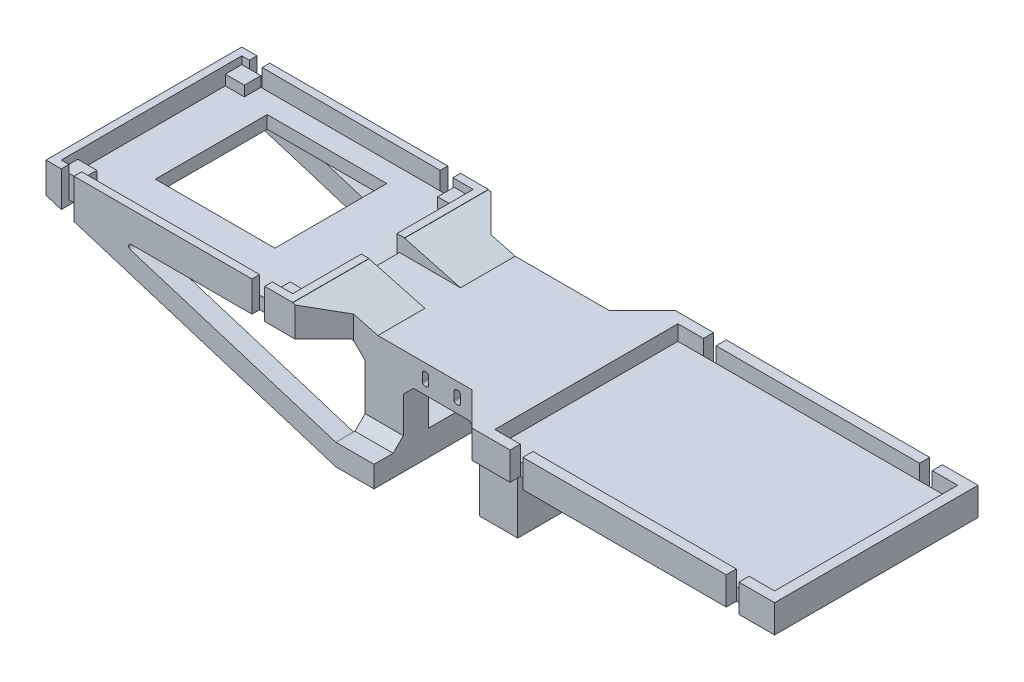
from build123d import *

# Parameters (mm, degrees)
SKETCH2_W            = 54
SKETCH2_H            = 41.5
SKETCH2_W_2          = 34
SKETCH2_H_2          = 20.5
BOSS_EXTRUDE1_DEPTH  = 80
CUT_EXTRUDE2_REACH   = 103.224
SKETCH4_W            = 30
SKETCH4_H            = 30.5
SKETCH4_W_2          = 20
SKETCH7_W            = 91
SKETCH7_H            = 71
BOSS_EXTRUDE2_DEPTH  = 5
SKETCH8_W            = 47
SKETCH8_H            = 44
CUT_EXTRUDE3_DEPTH   = 6
SKETCH10_W           = 97
SKETCH10_H           = 77
BOSS_EXTRUDE3_DEPTH  = 12
SKETCH11_W           = 7.5
SKETCH11_H           = 6.5
BOSS_EXTRUDE4_DEPTH  = 4
SKETCH12_W           = 3
SKETCH12_H           = 14
CUT_EXTRUDE5_DEPTH   = 6
SKETCH13_W           = 2.5
SKETCH13_H           = 5
CUT_EXTRUDE6_DEPTH   = 54
BOSS_EXTRUDE5_REACH  = 194.705
CUT_EXTRUDE8_REACH   = 186.43
SKETCH18_W           = 114
SKETCH18_H           = 63
CHAMFER2_SIZE        = 5
FILLET1_R            = 1
CHAMFER3_SIZE        = 4
CHAMFER4_SIZE        = 12.5
FILLET2_R            = 1
CHAMFER5_SIZE        = 1
FILLET2_OF_MIRROR1_R = 1
BOSS_EXTRUDE6_START  = -5
SKETCH19_W           = 110
SKETCH19_H           = 72
BOSS_EXTRUDE6_DEPTH  = 5
BOSS_EXTRUDE7_START  = -5
SKETCH21_W           = 118
SKETCH21_H           = 80
BOSS_EXTRUDE7_DEPTH  = 11
CHAMFER7_SIZE        = 14
CUT_EXTRUDE9_REACH   = 185.298
SKETCH22_W           = 5
SKETCH22_H           = 4
CUT_EXTRUDE10_START  = -12
SKETCH23_W           = 5
SKETCH23_H           = 3
CUT_EXTRUDE10_DEPTH  = 12
CUT_EXTRUDE11_REACH  = 184.034
SKETCH24_W           = 5
SKETCH24_H           = 77
CHAMFER8_SIZE        = 22
CHAMFER8_SIZE2       = 5.894882233


# Some blends are built 0.0001 mm under size
with BuildPart() as part:
    # Sketch2 → Boss-Extrude1 (new body)
    with BuildSketch(Plane(origin=(0, 0, 0), x_dir=(0, 0, -1), z_dir=(1, 0, 0))):
        with Locations((0, -9.75)):
            Rectangle(SKETCH2_W, SKETCH2_H)
        with Locations((0, -10.25)):
            Rectangle(SKETCH2_W_2, SKETCH2_H_2, mode=Mode.SUBTRACT)
    extrude(amount=-BOSS_EXTRUDE1_DEPTH)

    # Cut-Extrude2: up to this face of the body (flat: up to its plane)
    cut_extrude2_end = Plane(part.part.faces().sort_by_distance((-40, -9.75, -27))[0])
    # Sketch4 → Cut-Extrude2 (cut, up to the picked face)
    with BuildSketch(Plane.XY.offset(27), mode=Mode.PRIVATE) as cut_extrude2_sk1:
        with Locations((-30, -15.25)):
            Rectangle(SKETCH4_W, SKETCH4_H)
    cut_extrude2_tool1 = split(extrude(cut_extrude2_sk1.sketch, amount=-CUT_EXTRUDE2_REACH, mode=Mode.PRIVATE), bisect_by=cut_extrude2_end, keep=Keep.BOTH, mode=Mode.PRIVATE)
    # Sketch4 → Cut-Extrude2 (cut, up to the picked face)
    with BuildSketch(Plane.XY.offset(27), mode=Mode.PRIVATE) as cut_extrude2_sk2:
        with Locations((-70, -15.25)):
            Rectangle(SKETCH4_W_2, SKETCH4_H)
    cut_extrude2_tool2 = split(extrude(cut_extrude2_sk2.sketch, amount=-CUT_EXTRUDE2_REACH, mode=Mode.PRIVATE), bisect_by=cut_extrude2_end, keep=Keep.BOTH, mode=Mode.PRIVATE)
    add(cut_extrude2_tool1.solids().sort_by(Axis((-30, -15.25, 27), (0, 0, -1)))[0], mode=Mode.SUBTRACT)
    add(cut_extrude2_tool2.solids().sort_by(Axis((-70, -15.25, 27), (0, 0, -1)))[0], mode=Mode.SUBTRACT)

    # Sketch7 → Boss-Extrude2 (add)
    with BuildSketch(Plane(origin=(0, 5, 0), x_dir=(1, 0, 0), z_dir=(0, 1, 0))):
        with Locations((-125.5, 0)):
            Rectangle(SKETCH7_W, SKETCH7_H)
    extrude(amount=BOSS_EXTRUDE2_DEPTH)

    # Sketch8 → Cut-Extrude3 (cut)
    with BuildSketch(Plane(origin=(0, 11, 0), x_dir=(1, 0, 0), z_dir=(0, 1, 0))):
        with Locations((-129.5, 5.5)):
            Rectangle(SKETCH8_W, SKETCH8_H)
    extrude(amount=-CUT_EXTRUDE3_DEPTH, mode=Mode.SUBTRACT)

    # Sketch10 → Boss-Extrude3 (add)
    with BuildSketch(Plane.XZ.offset(-5)):
        with Locations((-125.5, 0)):
            Rectangle(SKETCH10_W, SKETCH10_H)
        Polygon((-80, 27), (-80, 35.5), (-171, 35.5), (-171, -35.5), (-80, -35.5), (-80, -27), align=None, mode=Mode.SUBTRACT)
    extrude(amount=-BOSS_EXTRUDE3_DEPTH)

    # Sketch11 → Boss-Extrude4 (add)
    with BuildSketch(Plane(origin=(0, 10, 0), x_dir=(1, 0, 0), z_dir=(0, 1, 0))):
        with Locations((-167.25, -32.25)):
            Rectangle(SKETCH11_W, SKETCH11_H)
        with Locations((-83.75, -32.25)):
            Rectangle(SKETCH11_W, SKETCH11_H)
        with Locations((-83.75, 32.25)):
            Rectangle(SKETCH11_W, SKETCH11_H)
        with Locations((-167.25, 32.25)):
            Rectangle(SKETCH11_W, SKETCH11_H)
    extrude(amount=BOSS_EXTRUDE4_DEPTH)

    # Sketch12 → Cut-Extrude5 (cut)
    with BuildSketch(Plane(origin=(0, 17, 0), x_dir=(1, 0, 0), z_dir=(0, 1, 0))):
        with Locations((-78.5, -1.5)):
            Rectangle(SKETCH12_W, SKETCH12_H)
    extrude(amount=-CUT_EXTRUDE5_DEPTH, mode=Mode.SUBTRACT)

    # Sketch13 → Cut-Extrude6 (cut)
    with BuildSketch(Plane.XY.offset(27)):
        with Locations((-23.75, 5.5)):
            Rectangle(SKETCH13_W, SKETCH13_H)
    cut_extrude6 = extrude(amount=-CUT_EXTRUDE6_DEPTH, mode=Mode.SUBTRACT)

    # Boss-Extrude5: up to this face of the body (flat: up to its plane)
    boss_extrude5_end = Plane(part.part.faces().sort_by_distance((-125.5, 11, -38.5))[0])
    # Sketch15 → Boss-Extrude5 (add, up to the picked face)
    with BuildSketch(Plane.XY.offset(38.5), mode=Mode.PRIVATE) as boss_extrude5_sk1:
        Polygon((-174, 5), (-60, -30.5), (-45, -30.5), (-45, -22.121084957), (-60, -22.121084957), (-147.093061552, 5), align=None)
    boss_extrude5_tool1 = split(extrude(boss_extrude5_sk1.sketch, amount=-BOSS_EXTRUDE5_REACH, mode=Mode.PRIVATE), bisect_by=boss_extrude5_end, keep=Keep.BOTH, mode=Mode.PRIVATE)
    add(boss_extrude5_tool1.solids().sort_by(Axis((-103.034337, -12.768903, 38.5), (0, 0, -1)))[0])

    # Cut-Extrude8: up to this face of the body (flat: up to its plane)
    cut_extrude8_end = Plane(part.part.faces().sort_by_distance((-105.982216644, 5, 2.901755115))[0])
    # Sketch18 → Cut-Extrude8 (cut, up to the picked face)
    with BuildSketch(Plane.XZ.offset(30.5), mode=Mode.PRIVATE) as cut_extrude8_sk1:
        with Locations((-117, 0)):
            Rectangle(SKETCH18_W, SKETCH18_H)
    cut_extrude8_tool1 = split(extrude(cut_extrude8_sk1.sketch, amount=-CUT_EXTRUDE8_REACH, mode=Mode.PRIVATE), bisect_by=cut_extrude8_end, keep=Keep.BOTH, mode=Mode.PRIVATE)
    add(cut_extrude8_tool1.solids().sort_by(Axis((-117, -30.5, 0), (0, 1, 0)))[0], mode=Mode.SUBTRACT)

    # Chamfer2
    chamfer2_edges = [part.edges().sort_by_distance(p)[0] for p in [
        (-60, 5, 0),
    ]]
    chamfer(chamfer2_edges, length=CHAMFER2_SIZE - 0.0001)  # a hair under: the kernel refuses the full size

    # Fillet1
    fillet1_edges = [part.edges().sort_by_distance(p)[0] for p in [
        (-60, -22.121084957, -35),
        (-147.093061552, 5, -35),
        (-147.093061552, 5, 35),
        (-60, -22.121084957, 35),
    ]]
    fillet(fillet1_edges, radius=FILLET1_R)

    # Chamfer3
    chamfer3_edges = [part.edges().sort_by_distance(p)[0] for p in [
        (-52.5, -22.121084957, 27),
        (-52.5, -22.121084957, -27),
        (-45, 0, 22),
        (-45, 0, -22),
        (-15, 0, 22),
        (-15, 0, -22),
    ]]
    chamfer(chamfer3_edges, length=CHAMFER3_SIZE)

    # Chamfer4
    # the kernel refuses this chamfer: 12.5 mm, written as the material it adds along each edge
    with BuildSketch(Plane(origin=(-77, 11, 27), x_dir=(-0.027495876610586587, 0, 0.9996219169112966), z_dir=(0, -1, 0))) as chamfer4_piece_1_section:
        Polygon((CHAMFER4_SIZE * 0.999621916911, -CHAMFER4_SIZE * 0.0274958766106), (-CHAMFER4_SIZE * 0.0274958766106, -CHAMFER4_SIZE * 0.999621916911), (0, 0), align=None)
    chamfer4_piece_1 = extrude(amount=6, mode=Mode.PRIVATE)
    chamfer4_piece_1 = split(chamfer4_piece_1, bisect_by=Plane(origin=(-68.359552988, 8.359652988, 28.292902516), z_dir=(0.7071067811865472, 0.7071067811865478, 0)), keep=Keep.TOP, mode=Mode.PRIVATE)
    add(chamfer4_piece_1)
    with BuildSketch(Plane(origin=(-77, 11, 27), x_dir=(-0.027495876610586587, 0, 0.9996219169112966), z_dir=(0, -1, 0))) as chamfer4_piece_2_section:
        Polygon((CHAMFER4_SIZE * 0.999621916911, -CHAMFER4_SIZE * 0.0274958766106), (-CHAMFER4_SIZE * 0.0274958766106, -CHAMFER4_SIZE * 0.999621916911), (0, 0), align=None)
    chamfer4_piece_2 = extrude(amount=38.14603735, mode=Mode.PRIVATE)
    chamfer4_piece_2 = split(chamfer4_piece_2, bisect_by=Plane(origin=(-64.503738194, 5, 26.714487269), z_dir=(0, -1, 0)), keep=Keep.TOP, mode=Mode.PRIVATE)
    chamfer4_piece_2 = split(chamfer4_piece_2, bisect_by=Plane(origin=(-64.627778646, 4.627878646, 26.714487269), z_dir=(0.7071067811865472, 0.7071067811865478, 0)), keep=Keep.TOP, mode=Mode.PRIVATE)
    add(chamfer4_piece_2)
    with BuildSketch(Plane(origin=(-77, 11, 27), x_dir=(-0.027495876610586587, 0, 0.9996219169112966), z_dir=(0, -1, 0))) as chamfer4_piece_3_section:
        Polygon((CHAMFER4_SIZE * 0.999621916911, -CHAMFER4_SIZE * 0.0274958766106), (-CHAMFER4_SIZE * 0.0274958766106, -CHAMFER4_SIZE * 0.999621916911), (0, 0), align=None)
    chamfer4_piece_3 = extrude(amount=6, mode=Mode.PRIVATE)
    chamfer4_piece_3 = split(chamfer4_piece_3, bisect_by=Plane(origin=(-73.477032912, 7.846772168, 38.5), z_dir=(0, 0, -1)), keep=Keep.TOP, mode=Mode.PRIVATE)
    chamfer4_piece_3 = split(chamfer4_piece_3, bisect_by=Plane(origin=(-70.66185254, 10.66195254, 31.346666283), z_dir=(-0.7071067811865472, -0.7071067811865478, 0)), keep=Keep.TOP, mode=Mode.PRIVATE)
    add(chamfer4_piece_3)
    with BuildSketch(Plane(origin=(-77, -27.14603735, -27), x_dir=(-0.027495876610586587, 0, -0.9996219169112966), z_dir=(0, 1, 0))) as chamfer4_piece_4_section:
        Polygon((CHAMFER4_SIZE * 0.999621916911, -CHAMFER4_SIZE * 0.0274958766106), (-CHAMFER4_SIZE * 0.0274958766106, -CHAMFER4_SIZE * 0.999621916911), (0, 0), align=None)
    chamfer4_piece_4 = extrude(amount=38.14603735, mode=Mode.PRIVATE)
    chamfer4_piece_4 = split(chamfer4_piece_4, bisect_by=Plane(origin=(-64.627778646, 4.627878646, -26.714487269), z_dir=(0.7071067811865472, 0.7071067811865478, 0)), keep=Keep.TOP, mode=Mode.PRIVATE)
    chamfer4_piece_4 = split(chamfer4_piece_4, bisect_by=Plane(origin=(-64.503738194, 5, -26.714487269), z_dir=(0, -1, 0)), keep=Keep.TOP, mode=Mode.PRIVATE)
    add(chamfer4_piece_4)
    with BuildSketch(Plane(origin=(-77, 5, -27), x_dir=(-0.027495876610586587, 0, -0.9996219169112966), z_dir=(0, 1, 0))) as chamfer4_piece_5_section:
        Polygon((CHAMFER4_SIZE * 0.999621916911, -CHAMFER4_SIZE * 0.0274958766106), (-CHAMFER4_SIZE * 0.0274958766106, -CHAMFER4_SIZE * 0.999621916911), (0, 0), align=None)
    chamfer4_piece_5 = extrude(amount=6, mode=Mode.PRIVATE)
    chamfer4_piece_5 = split(chamfer4_piece_5, bisect_by=Plane(origin=(-73.477032912, 7.846772168, -38.5), z_dir=(0, 0, 1)), keep=Keep.TOP, mode=Mode.PRIVATE)
    chamfer4_piece_5 = split(chamfer4_piece_5, bisect_by=Plane(origin=(-70.66185254, 10.66195254, -31.346666283), z_dir=(-0.7071067811865472, -0.7071067811865478, 0)), keep=Keep.TOP, mode=Mode.PRIVATE)
    add(chamfer4_piece_5)
    with BuildSketch(Plane(origin=(-77, 5, -27), x_dir=(-0.027495876610586587, 0, -0.9996219169112966), z_dir=(0, 1, 0))) as chamfer4_piece_6_section:
        Polygon((CHAMFER4_SIZE * 0.999621916911, -CHAMFER4_SIZE * 0.0274958766106), (-CHAMFER4_SIZE * 0.0274958766106, -CHAMFER4_SIZE * 0.999621916911), (0, 0), align=None)
    chamfer4_piece_6 = extrude(amount=6, mode=Mode.PRIVATE)
    chamfer4_piece_6 = split(chamfer4_piece_6, bisect_by=Plane(origin=(-68.359552988, 8.359652988, -28.292902516), z_dir=(0.7071067811865472, 0.7071067811865478, 0)), keep=Keep.TOP, mode=Mode.PRIVATE)
    add(chamfer4_piece_6)

    # Fillet2
    fillet2_edges = [part.edges().sort_by_distance(p)[0] for p in [
        (-22.5, 3, 0),
        (-22.5, 8, 0),
        (-25, 8, 0),
        (-25, 3, 0),
    ]]
    fillet(fillet2_edges, radius=FILLET2_R)

    # Chamfer5
    chamfer5_edges = [part.edges().sort_by_distance(p)[0] for p in [
        (-80, 11, 1.5),
    ]]
    chamfer(chamfer5_edges, length=CHAMFER5_SIZE - 0.0001)  # a hair under: the kernel refuses the full size

    # Mirror1: Cut-Extrude6 across plane
    add(cut_extrude6.mirror(Plane(origin=(-30, 0, 0), x_dir=(0, 0, 1), z_dir=(1, 0, 0))), mode=Mode.SUBTRACT)

    # Fillet2 of Mirror1
    fillet2_of_mirror1_edges = [part.edges().sort_by_distance(p)[0] for p in [
        (-37.5, 3, 0),
        (-37.5, 8, 0),
        (-35, 8, 0),
        (-35, 3, 0),
    ]]
    fillet(fillet2_of_mirror1_edges, radius=FILLET2_OF_MIRROR1_R)

    # Sketch19 → Boss-Extrude6 (add)
    with BuildSketch(Plane(origin=(0, 5, 0), x_dir=(1, 0, 0), z_dir=(0, 1, 0)).offset(BOSS_EXTRUDE6_START)):
        with Locations((55, 0)):
            Rectangle(SKETCH19_W, SKETCH19_H)
    extrude(amount=BOSS_EXTRUDE6_DEPTH)

    # Sketch21 → Boss-Extrude7 (add)
    with BuildSketch(Plane(origin=(0, 5, 0), x_dir=(1, 0, 0), z_dir=(0, 1, 0)).offset(BOSS_EXTRUDE7_START)):
        with Locations((55, 0)):
            Rectangle(SKETCH21_W, SKETCH21_H)
        Polygon((0, 36), (0, 27), (0, -27), (0, -36), (110, -36), (110, 36), align=None, mode=Mode.SUBTRACT)
    extrude(amount=BOSS_EXTRUDE7_DEPTH)

    # Chamfer7
    # the kernel refuses this chamfer: 14 mm, written as the material it adds along each edge
    with BuildSketch(Plane(origin=(-4, 0, -27), x_dir=(-0.9996219169112968, 0, 0.02749587661058612), z_dir=(0, 1, 0))) as chamfer7_piece_1_section:
        Polygon((CHAMFER7_SIZE * 0.999621916911, -CHAMFER7_SIZE * 0.0274958766106), (-CHAMFER7_SIZE * 0.0274958766106, -CHAMFER7_SIZE * 0.999621916911), (0, 0), align=None)
    chamfer7_piece_1 = extrude(amount=11, mode=Mode.PRIVATE)
    chamfer7_piece_1 = split(chamfer7_piece_1, bisect_by=Plane(origin=(-16, 5.5, -40), z_dir=(0, 0, 1)), keep=Keep.TOP, mode=Mode.PRIVATE)
    add(chamfer7_piece_1)
    with BuildSketch(Plane(origin=(-4, 11, 27), x_dir=(-0.9996219169112968, 0, -0.02749587661058612), z_dir=(0, -1, 0))) as chamfer7_piece_2_section:
        Polygon((CHAMFER7_SIZE * 0.999621916911, -CHAMFER7_SIZE * 0.0274958766106), (-CHAMFER7_SIZE * 0.0274958766106, -CHAMFER7_SIZE * 0.999621916911), (0, 0), align=None)
    chamfer7_piece_2 = extrude(amount=11, mode=Mode.PRIVATE)
    chamfer7_piece_2 = split(chamfer7_piece_2, bisect_by=Plane(origin=(-16, 5.5, 40), z_dir=(0, 0, -1)), keep=Keep.TOP, mode=Mode.PRIVATE)
    add(chamfer7_piece_2)

    # Cut-Extrude9: up to this face of the body (flat: up to its plane)
    cut_extrude9_end = Plane(part.part.faces().sort_by_distance((37.275205199, 0, 0))[0])
    # Sketch22 → Cut-Extrude9 (cut, up to the picked face)
    with BuildSketch(Plane(origin=(0, 11, 0), x_dir=(1, 0, 0), z_dir=(0, 1, 0)), mode=Mode.PRIVATE) as cut_extrude9_sk1:
        with Locations((97.5, 38)):
            Rectangle(SKETCH22_W, SKETCH22_H)
    cut_extrude9_tool1 = split(extrude(cut_extrude9_sk1.sketch, amount=-CUT_EXTRUDE9_REACH, mode=Mode.PRIVATE), bisect_by=cut_extrude9_end, keep=Keep.BOTH, mode=Mode.PRIVATE)
    # Sketch22 → Cut-Extrude9 (cut, up to the picked face)
    with BuildSketch(Plane(origin=(0, 11, 0), x_dir=(1, 0, 0), z_dir=(0, 1, 0)), mode=Mode.PRIVATE) as cut_extrude9_sk2:
        with Locations((97.5, -38)):
            Rectangle(SKETCH22_W, SKETCH22_H)
    cut_extrude9_tool2 = split(extrude(cut_extrude9_sk2.sketch, amount=-CUT_EXTRUDE9_REACH, mode=Mode.PRIVATE), bisect_by=cut_extrude9_end, keep=Keep.BOTH, mode=Mode.PRIVATE)
    # Sketch22 → Cut-Extrude9 (cut, up to the picked face)
    with BuildSketch(Plane(origin=(0, 11, 0), x_dir=(1, 0, 0), z_dir=(0, 1, 0)), mode=Mode.PRIVATE) as cut_extrude9_sk3:
        with Locations((12.5, -38)):
            Rectangle(SKETCH22_W, SKETCH22_H)
    cut_extrude9_tool3 = split(extrude(cut_extrude9_sk3.sketch, amount=-CUT_EXTRUDE9_REACH, mode=Mode.PRIVATE), bisect_by=cut_extrude9_end, keep=Keep.BOTH, mode=Mode.PRIVATE)
    # Sketch22 → Cut-Extrude9 (cut, up to the picked face)
    with BuildSketch(Plane(origin=(0, 11, 0), x_dir=(1, 0, 0), z_dir=(0, 1, 0)), mode=Mode.PRIVATE) as cut_extrude9_sk4:
        with Locations((12.5, 38)):
            Rectangle(SKETCH22_W, SKETCH22_H)
    cut_extrude9_tool4 = split(extrude(cut_extrude9_sk4.sketch, amount=-CUT_EXTRUDE9_REACH, mode=Mode.PRIVATE), bisect_by=cut_extrude9_end, keep=Keep.BOTH, mode=Mode.PRIVATE)
    add(cut_extrude9_tool1.solids().sort_by(Axis((97.5, 11, -38), (0, -1, 0)))[0], mode=Mode.SUBTRACT)
    add(cut_extrude9_tool2.solids().sort_by(Axis((97.5, 11, 38), (0, -1, 0)))[0], mode=Mode.SUBTRACT)
    add(cut_extrude9_tool3.solids().sort_by(Axis((12.5, 11, 38), (0, -1, 0)))[0], mode=Mode.SUBTRACT)
    add(cut_extrude9_tool4.solids().sort_by(Axis((12.5, 11, -38), (0, -1, 0)))[0], mode=Mode.SUBTRACT)

    # Sketch23 → Cut-Extrude10 (cut)
    with BuildSketch(Plane(origin=(0, 17, 0), x_dir=(1, 0, 0), z_dir=(0, 1, 0)).offset(CUT_EXTRUDE10_START)):
        with Locations((-165.5, 37)):
            Rectangle(SKETCH23_W, SKETCH23_H)
        with Locations((-90.5, 37)):
            Rectangle(SKETCH23_W, SKETCH23_H)
        with Locations((-90.5, -37)):
            Rectangle(SKETCH23_W, SKETCH23_H)
        with Locations((-165.5, -37)):
            Rectangle(SKETCH23_W, SKETCH23_H)
    extrude(amount=CUT_EXTRUDE10_DEPTH, mode=Mode.SUBTRACT)

    # Cut-Extrude11: up to this plane
    cut_extrude11_end = Plane(origin=(-174, 5, -172.29555299), z_dir=(-0.29732108004363994, -0.9547775528161958, 0))
    # Sketch24 → Cut-Extrude11 (cut, up to the surface)
    with BuildSketch(Plane.XZ.offset(-5), mode=Mode.PRIVATE) as cut_extrude11_sk1:
        with Locations((-165.5, 0)):
            Rectangle(SKETCH24_W, SKETCH24_H)
    cut_extrude11_tool1 = split(extrude(cut_extrude11_sk1.sketch, amount=CUT_EXTRUDE11_REACH, mode=Mode.PRIVATE), bisect_by=cut_extrude11_end, keep=Keep.BOTH, mode=Mode.PRIVATE)
    add(cut_extrude11_tool1.solids().sort_by_distance((-165.5, 5, 0))[0], mode=Mode.SUBTRACT)

    # Chamfer8
    chamfer8_edges = [part.edges().sort_by_distance(p)[0] for p in [
        (-77, 11, -22),
        (-77, 11, 23.5),
    ]]
    chamfer8_side = [part.faces().sort_by_distance(p)[0] for p in [
        (-37.089758736, 11, 0.008898276),
    ]]
    chamfer(chamfer8_edges, length=CHAMFER8_SIZE, length2=CHAMFER8_SIZE2, reference=chamfer8_side[0])


solid = part.part
